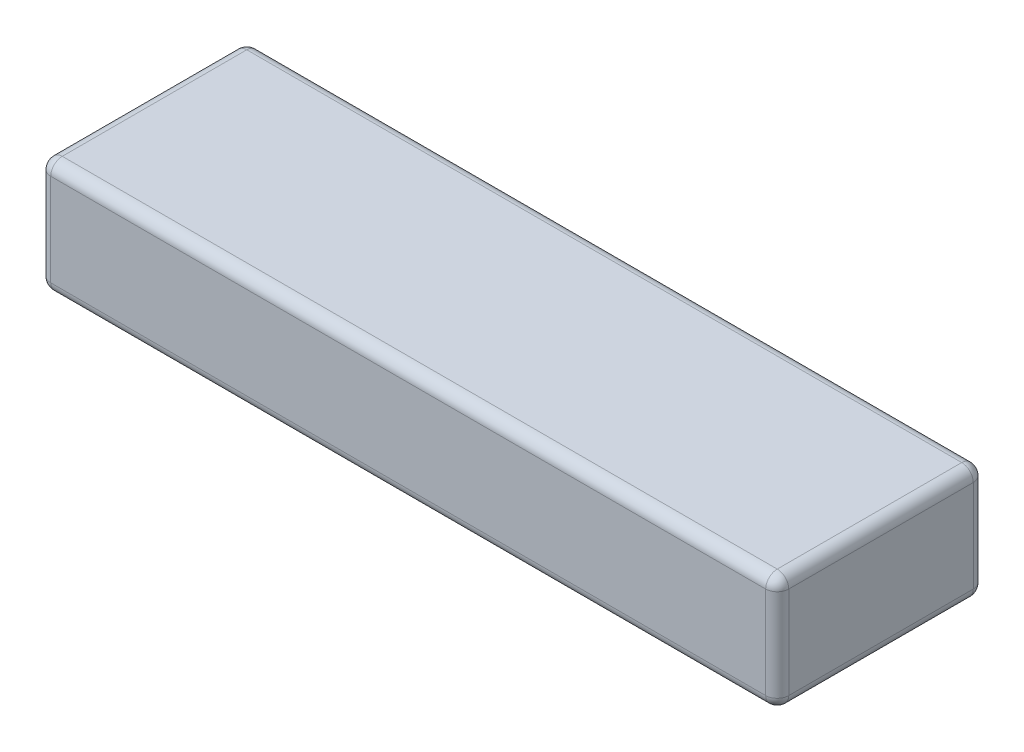
from build123d import *

# Parameters (mm, degrees)
SKETCH1_W           = 160
SKETCH1_H           = 45
BOSS_EXTRUDE1_DEPTH = 25
FILLET1_R           = 2.5


with BuildPart() as part:
    # Sketch1 → Boss-Extrude1 (new body)
    with BuildSketch(Plane(origin=(0, 0, 0), x_dir=(1, 0, 0), z_dir=(0, 1, 0))):
        Rectangle(SKETCH1_W, SKETCH1_H)
    extrude(amount=BOSS_EXTRUDE1_DEPTH)

    # Fillet1
    fillet1_edges = [part.edges().sort_by_distance(p)[0] for p in [
        (80, 12.5, -22.5),
        (-80, 12.5, -22.5),
        (-80, 12.5, 22.5),
        (80, 12.5, 22.5),
        (0, 25, 22.5),
        (-80, 25, 0),
        (0, 25, -22.5),
        (80, 25, 0),
        (0, 0, -22.5),
        (-80, 0, 0),
        (0, 0, 22.5),
        (80, 0, 0),
    ]]
    fillet(fillet1_edges, radius=FILLET1_R)


solid = part.part
